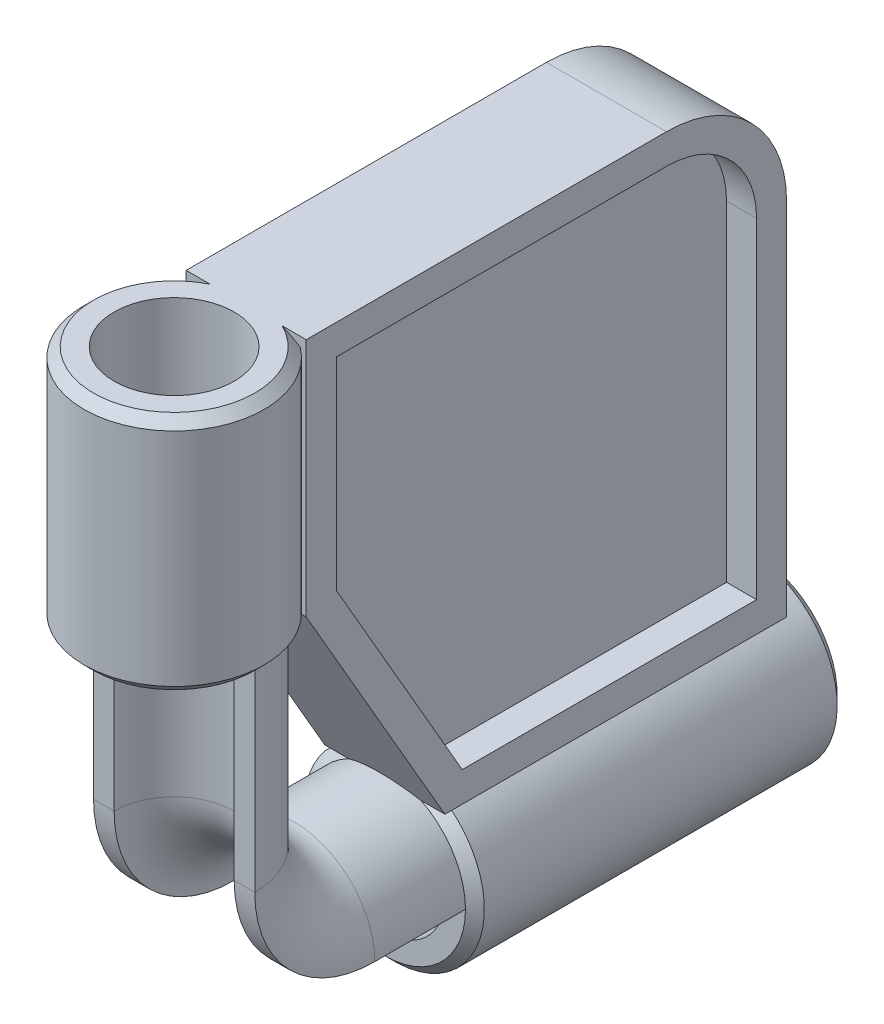
from build123d import *

# Parameters (mm, degrees)
BOSS_EXTRUDE1_DEPTH      = 6.35
FILLET1_R                = 12.7
CUT_EXTRUDE2_DEPTH       = 3.175
BOSS_EXTRUDE2_DEPTH      = 3.175
BOSS_EXTRUDE2_DEPTH_BACK = 36.135303
SKETCH4_R                = 9.525
SKETCH4_R_2              = 6.35
SKETCH5_R                = 9.525
SKETCH5_R_2              = 6.35
BOSS_EXTRUDE3_DEPTH      = 25.4
CHAMFER2_SIZE            = 1


with BuildPart() as part:
    # Sketch1 → Boss-Extrude1 (new, symmetric)
    with BuildSketch(Plane.YZ):
        Polygon((-25.4, 10.735303163), (0, 25.4), (25.4, 25.4), (25.4, -25.4), (-25.4, -25.4), align=None)
    extrude(amount=BOSS_EXTRUDE1_DEPTH, both=True)

    # Fillet1
    fillet1_edges = [part.edges().sort_by_distance(p)[0] for p in [
        (0, 25.4, -25.4),
    ]]
    fillet(fillet1_edges, radius=FILLET1_R)

    # Sketch3 → Cut-Extrude2 (cut)
    with BuildSketch(Plane.YZ.offset(6.35)):
        with BuildLine():
            Line((-22.225, -22.225), (12.7, -22.225))
            ThreePointArc((12.7, -22.225), (19.435192091, -19.435192091), (22.225, -12.7))
            Line((22.225, -12.7), (22.225, 22.225))
            Line((22.225, 22.225), (0.850738686, 22.225))
            Line((0.850738686, 22.225), (-22.225, 8.902216058))
            Line((-22.225, 8.902216058), (-22.225, -22.225))
        make_face()
    cut_extrude2 = extrude(amount=-CUT_EXTRUDE2_DEPTH, mode=Mode.SUBTRACT)

    # Mirror1: Cut-Extrude2 across plane
    add(cut_extrude2.mirror(Plane(origin=(0, 0, 0), x_dir=(0, 0, 1), z_dir=(1, 0, 0))), mode=Mode.SUBTRACT)

    # Sketch4 → Boss-Extrude2 (add, two sides: drawn at the far end of the back side and taken through both)
    with BuildSketch(Plane(origin=(0, 0, -25.4), x_dir=(1, 0, 0), z_dir=(0, 0, -1)).offset(-BOSS_EXTRUDE2_DEPTH_BACK)):
        with Locations(Location((0, 33.02, 0), (0, 0, 233.130102354))):
            Circle(SKETCH4_R)
        with Locations(Location((0, 33.02, 0), (0, 0, 270))):
            Circle(SKETCH4_R_2, mode=Mode.SUBTRACT)
    extrude(amount=BOSS_EXTRUDE2_DEPTH + BOSS_EXTRUDE2_DEPTH_BACK)

    # Sketch5 → Boss-Extrude3 (add)
    with BuildSketch(Plane(origin=(0, 25.4, 0), x_dir=(-1, 0, 0), z_dir=(0, 1, 0))):
        with Locations((0, 33.02)):
            Circle(SKETCH5_R)
        with Locations(Location((0, 33.02, 0), (0, 0, 90))):
            Circle(SKETCH5_R_2, mode=Mode.SUBTRACT)
    extrude(amount=-BOSS_EXTRUDE3_DEPTH)

    # Chamfer2
    # the kernel refuses this chamfer: 1 mm, written as the material it takes off along each edge
    with BuildSketch(Plane(origin=(0, -33.02, 10.735303), x_dir=(0.3638595085405839, 0.931453841070294, 0), z_dir=(-0.931453841070294, 0.3638595085405839, 0))) as chamfer2_piece_1_section:
        Polygon((9.525, CHAMFER2_SIZE), (9.525 - CHAMFER2_SIZE, 0), (9.525, 0), align=None)
    chamfer2_piece_1 = revolve(axis=Axis((0, -33.02, 10.735303), (0, 0, -1)), revolution_arc=317.325176487, mode=Mode.PRIVATE)
    chamfer2_piece_1 = split(chamfer2_piece_1, bisect_by=Plane(origin=(5.777045626, -25.4, 10.24862198), z_dir=(0, -1, 0)), keep=Keep.TOP, mode=Mode.PRIVATE)
    add(chamfer2_piece_1, mode=Mode.SUBTRACT)
    with BuildSketch(Plane(origin=(0, -33.02, -28.575), x_dir=(-0.6000000000021781, 0.7999999999983665, 0), z_dir=(-0.7999999999983665, -0.6000000000021781, 0))) as chamfer2_piece_2:
        Polygon((9.525, -CHAMFER2_SIZE), (9.525 - CHAMFER2_SIZE, 0), (9.525, 0), align=None)
    revolve(axis=Axis((0, -33.02, -28.575), (0, 0, -1)), mode=Mode.SUBTRACT)
    with BuildSketch(Plane(origin=(0, 25.4, 33.02), x_dir=(-0.3638595085405501, 0, -0.9314538410703074), z_dir=(0.9314538410703074, 0, -0.3638595085405501))) as chamfer2_piece_3_section:
        Polygon((9.525, -CHAMFER2_SIZE), (9.525 - CHAMFER2_SIZE, 0), (9.525, 0), align=None)
    chamfer2_piece_3 = revolve(axis=Axis((0, 25.4, 33.02), (0, 1, 0)), revolution_arc=317.325176487, mode=Mode.PRIVATE)
    chamfer2_piece_3 = split(chamfer2_piece_3, bisect_by=Plane(origin=(0, 24.920234358, 25.4), z_dir=(0, 0, 1)), keep=Keep.TOP, mode=Mode.PRIVATE)
    add(chamfer2_piece_3, mode=Mode.SUBTRACT)
    with BuildSketch(Plane(origin=(0, 0, 33.02), x_dir=(-0.3638595085405531, 0, -0.9314538410703063), z_dir=(0.9314538410703063, 0, -0.3638595085405531))) as chamfer2_piece_4_section:
        Polygon((9.525, CHAMFER2_SIZE), (9.525 - CHAMFER2_SIZE, 0), (9.525, 0), align=None)
    chamfer2_piece_4 = revolve(axis=Axis((0, 0, 33.02), (0, 1, 0)), revolution_arc=317.325176487, mode=Mode.PRIVATE)
    chamfer2_piece_4 = split(chamfer2_piece_4, bisect_by=Plane(origin=(-5.452412952, 0.490850729, 25.4), z_dir=(0, 0, 1)), keep=Keep.TOP, mode=Mode.PRIVATE)
    add(chamfer2_piece_4, mode=Mode.SUBTRACT)

    # Sweep3: sweep along a path in Sketch6
    with BuildLine(Plane.YZ) as sweep3_path:
        Line((0, 33.02), (-20.32, 33.02))
        ThreePointArc((-20.32, 33.02), (-29.300256121, 29.300256121), (-33.02, 20.32))
        Line((-33.02, 20.32), (-33.02, 10.735303163))
    # Sketch7 → Sweep3 (sweep)
    with BuildSketch(Plane.XZ):
        with BuildLine():
            Line((-8.525, 33.02), (-6.35, 33.02))
            ThreePointArc((-6.35, 33.02), (0, 26.67), (6.35, 33.02))
            Line((6.35, 33.02), (8.525, 33.02))
            ThreePointArc((8.525, 33.02), (0, 24.495), (-8.525, 33.02))
        make_face()
    sweep(path=sweep3_path.line)


solid = part.part
